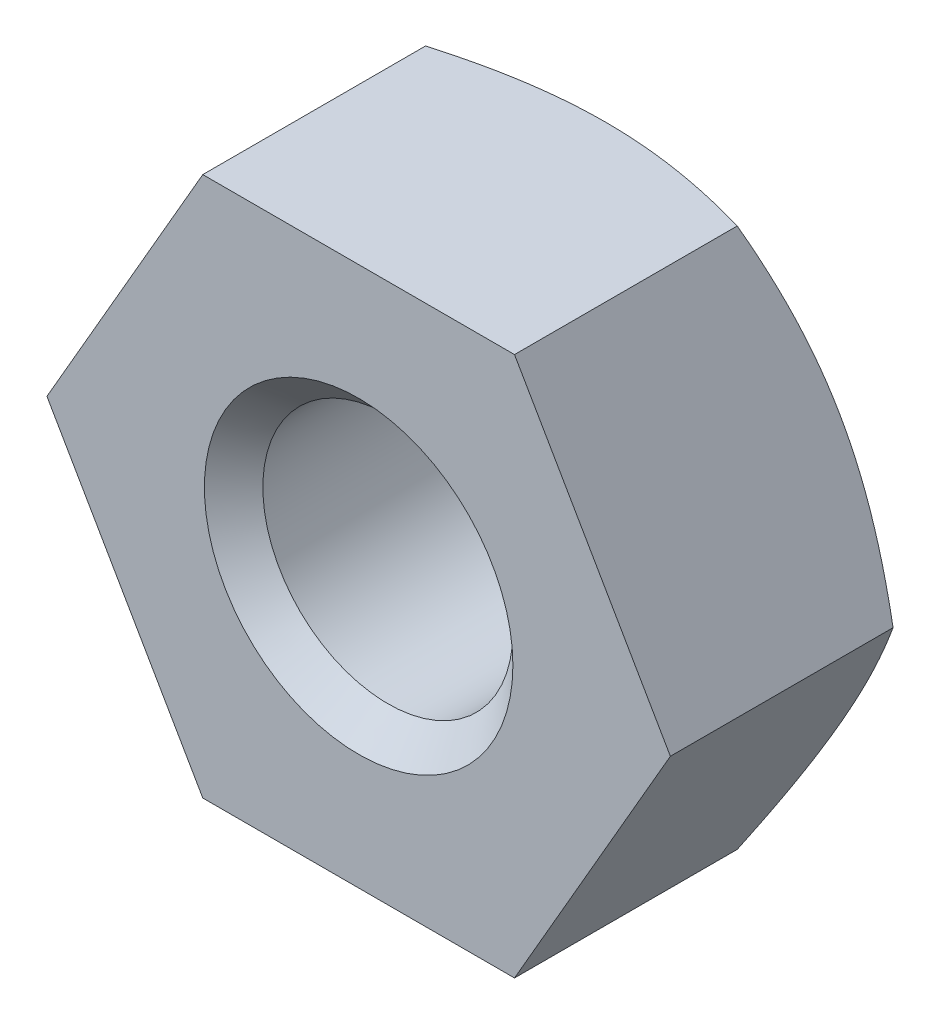
from build123d import *

# Parameters (mm, degrees)
SKETCH_2_R          = 14
CUT_EXTRUDE_1_DEPTH = 3.2


with BuildPart() as part:
    # 草图1 → 旋转1 (revolve)
    with BuildSketch(Plane(origin=(0, 0, 0), x_dir=(0, 0, -1), z_dir=(1, 0, 0))):
        Polygon((0, 0), (0, 9.042562584), (3.2, 3.5), (3.2, 0), align=None)
    revolve(axis=Axis((0, 0, -3.2), (0, 0, 1)))

    # 草图2 → 切除-拉伸1 (cut)
    with BuildSketch(Plane(origin=(0, 0, -3.2), x_dir=(-1, 0, 0), z_dir=(0, 0, -1))):
        Circle(SKETCH_2_R)
        Polygon((-2.020725942, -3.5), (2.020725942, -3.5), (4.041451884, 0), (2.020725942, 3.5), (-2.020725942, 3.5), (-4.041451884, 0), align=None, mode=Mode.SUBTRACT)
    extrude(amount=-CUT_EXTRUDE_1_DEPTH, mode=Mode.SUBTRACT)

    # 草图3 → 切除-旋转1 (revolve, cut)
    with BuildSketch(Plane(origin=(0, 0, 0), x_dir=(0, 0, -1), z_dir=(1, 0, 0))):
        Polygon((0, 0), (0, 2), (0.379, 1.621), (2.821, 1.621), (3.2, 2), (3.2, 0), align=None)
    revolve(axis=Axis((0, 0, -3.2), (0, 0, 1)), mode=Mode.SUBTRACT)


solid = part.part
